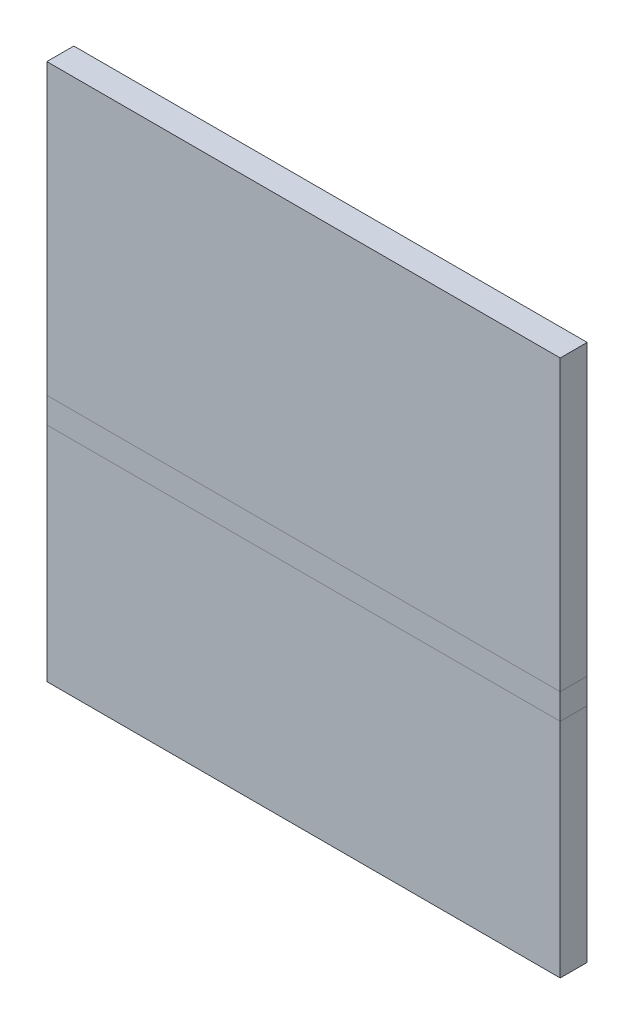
from build123d import *

# Parameters (mm, degrees)
SKETCH1_W                    = 50.8
SKETCH1_H                    = 25.4
BASE_FLANGE1_DEPTH           = 2.667
EDGE_FLANGE1_STRIP_W         = 12.1412
EDGE_FLANGE1_STRIP_H         = 2.667
EDGE_FLANGE1_STRIP_CUT_DEPTH = 50.8
EDGE_FLANGE1_DEPTH           = 50.8
UNFOLD1_DEPTH                = 50.8
UNFOLD1_2_DEPTH              = 50.8


# Read off the part's stored shape, not the designer's step: Unfold1
# Sheet-metal steps are written as plain solids
with BuildPart() as part:
    # Sketch1 → Base-Flange1 (new body)
    with BuildSketch(Plane.XY):
        with Locations((25.4, 12.7)):
            Rectangle(SKETCH1_W, SKETCH1_H)
    extrude(amount=-BASE_FLANGE1_DEPTH)

    # Edge-Flange1 strip (across the edge) → Edge-Flange1 strip cut (cut)
    with BuildSketch(Plane(origin=(50.8, 25.4, 0), x_dir=(0, -1, 0), z_dir=(-1, 0, 0))):
        with Locations((-2.667, -1.3335)):
            Rectangle(EDGE_FLANGE1_STRIP_W, EDGE_FLANGE1_STRIP_H)
    extrude(amount=EDGE_FLANGE1_STRIP_CUT_DEPTH, mode=Mode.SUBTRACT)

    # Edge-Flange1 section (across the edge) → Edge-Flange1 (add)
    with BuildSketch(Plane(origin=(50.8, 25.4, 0), x_dir=(0, -1, 0), z_dir=(-1, 0, 0))):
        with BuildLine():
            Line((0, 0.7366), (0, 29.337))
            Line((0, 29.337), (2.667, 29.337))
            Line((2.667, 29.337), (2.667, 0.7366))
            ThreePointArc((2.667, 0.7366), (2.882745145, 0.215745145), (3.4036, 0))
            Line((3.4036, 0), (3.4036, -2.667))
            ThreePointArc((3.4036, -2.667), (0.99689136, -1.67010864), (0, 0.7366))
        make_face()
    extrude(amount=EDGE_FLANGE1_DEPTH)

    # Unfold1 outline → Unfold1 (cut)
    with BuildSketch(Plane.YZ):
        with BuildLine():
            Line((21.9964, 0), (25.319337465, 0))
            ThreePointArc((25.319337465, 0), (25.379774271, 0.366098312), (25.4, 0.7366))
            Line((25.4, 0.7366), (25.4, 29.337))
            Line((25.4, 29.337), (22.733, 29.337))
            Line((22.733, 29.337), (22.733, 0.7366))
            ThreePointArc((22.733, 0.7366), (22.517254855, 0.215745145), (21.9964, 0))
        make_face()
    extrude(amount=UNFOLD1_DEPTH, mode=Mode.SUBTRACT)

    # Unfold1 2 outline → Unfold1 2 (add)
    with BuildSketch(Plane.YZ):
        with BuildLine():
            Line((21.9964, -2.667), (53.136322129, -2.667))
            Line((53.136322129, -2.667), (53.136322129, 0))
            Line((53.136322129, 0), (25.319337465, 0))
            ThreePointArc((25.319337465, 0), (24.126822634, -1.917791146), (21.9964, -2.667))
        make_face()
    extrude(amount=UNFOLD1_2_DEPTH)


solid = part.part
